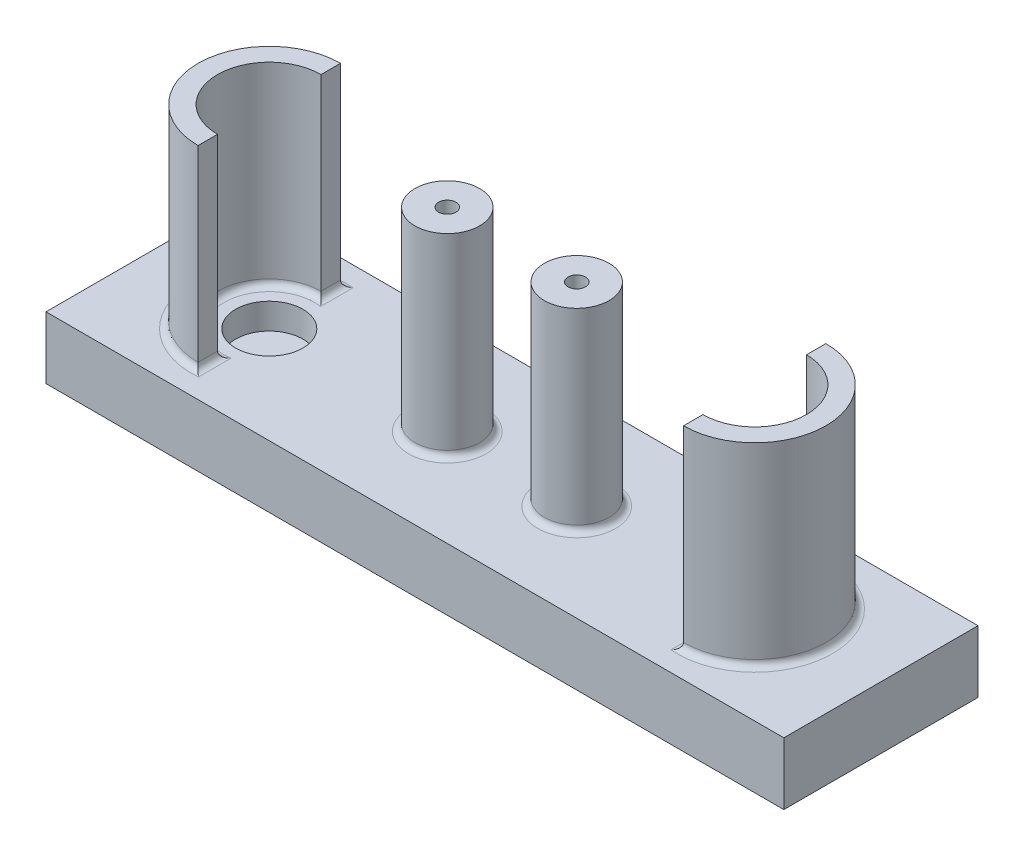
from build123d import *

# Parameters (mm, degrees)
SKETCH1_W           = 144.78
SKETCH1_H           = 38.1
SKETCH1_R           = 1.7
BOSS_EXTRUDE1_DEPTH = 12.7
SKETCH2_R           = 6.6
CUT_EXTRUDE1_DEPTH  = 5.08
SKETCH4_R           = 6.35
SKETCH4_R_2         = 1.7
BOSS_EXTRUDE2_DEPTH = 38.1
FILLET1_R           = 1.27
CHAMFER1_SIZE       = 0.5


with BuildPart() as part:
    # Sketch1 → Boss-Extrude1 (new body)
    with BuildSketch(Plane(origin=(0, 0, 0), x_dir=(1, 0, 0), z_dir=(0, 1, 0))):
        with Locations((72.39, 19.05)):
            Rectangle(SKETCH1_W, SKETCH1_H)
        with Locations((59.69, 19.05)):
            Circle(SKETCH1_R, mode=Mode.SUBTRACT)
        with Locations((85.09, 19.05)):
            Circle(SKETCH1_R, mode=Mode.SUBTRACT)
    extrude(amount=BOSS_EXTRUDE1_DEPTH)

    # Sketch2 → Cut-Extrude1 (cut)
    with BuildSketch(Plane(origin=(0, 12.7, 0), x_dir=(1, 0, 0), z_dir=(0, 1, 0))):
        with Locations((24.765, 19.05)):
            Circle(SKETCH2_R)
        with Locations((120.015, 19.05)):
            Circle(SKETCH2_R)
    extrude(amount=-CUT_EXTRUDE1_DEPTH, mode=Mode.SUBTRACT)

    # Sketch4 → Boss-Extrude2 (add)
    # profile 1 of 4: a face of its own
    with BuildSketch(Plane(origin=(0, 12.7, 0), x_dir=(1, 0, 0), z_dir=(0, 1, 0))):
        with Locations((85.09, 19.05)):
            Circle(SKETCH4_R)
        with Locations((85.09, 19.05)):
            Circle(SKETCH4_R_2, mode=Mode.SUBTRACT)
    # profile 2 of 4: a face of its own
    with BuildSketch(Plane(origin=(0, 12.7, 0), x_dir=(1, 0, 0), z_dir=(0, 1, 0))):
        with Locations((59.69, 19.05)):
            Circle(SKETCH4_R)
        with Locations((59.69, 19.05)):
            Circle(SKETCH4_R_2, mode=Mode.SUBTRACT)
    # profile 3 of 4: a face of its own
    with BuildSketch(Plane(origin=(0, 12.7, 0), x_dir=(1, 0, 0), z_dir=(0, 1, 0))):
        with BuildLine():
            Line((24.765, 33.02), (24.765, 29.21))
            ThreePointArc((24.765, 29.21), (14.605, 19.05), (24.765, 8.89))
            Line((24.765, 8.89), (24.765, 5.08))
            ThreePointArc((24.765, 5.08), (10.795, 19.05), (24.765, 33.02))
        make_face()
    # profile 4 of 4: a face of its own
    with BuildSketch(Plane(origin=(0, 12.7, 0), x_dir=(1, 0, 0), z_dir=(0, 1, 0))):
        with BuildLine():
            Line((120.015, 8.89), (120.015, 5.08))
            ThreePointArc((120.015, 5.08), (133.985, 19.05), (120.015, 33.02))
            Line((120.015, 33.02), (120.015, 29.21))
            ThreePointArc((120.015, 29.21), (130.175, 19.05), (120.015, 8.89))
        make_face()
    extrude(amount=BOSS_EXTRUDE2_DEPTH)

    # Fillet1
    fillet1_edges = [part.edges().sort_by_distance(p)[0] for p in [
        (120.015, 12.7, -31.115),
        (130.175, 12.7, -19.05),
        (120.015, 12.7, -6.985),
        (133.985, 12.7, -19.05),
        (24.765, 12.7, -6.985),
        (24.765, 12.7, -31.115),
        (14.605, 12.7, -19.05),
        (10.795, 12.7, -19.05),
        (78.74, 12.7, -19.05),
        (53.34, 12.7, -19.05),
    ]]
    fillet(fillet1_edges, radius=FILLET1_R)

    # Chamfer1
    chamfer1_edges = [part.edges().sort_by_distance(p)[0] for p in [
        (72.39, 0, 0),
        (144.78, 0, -19.05),
        (72.39, 0, -38.1),
        (0, 0, -19.05),
        (83.39, 0, -19.05),
        (57.99, 0, -19.05),
    ]]
    chamfer(chamfer1_edges, length=CHAMFER1_SIZE)


solid = part.part
